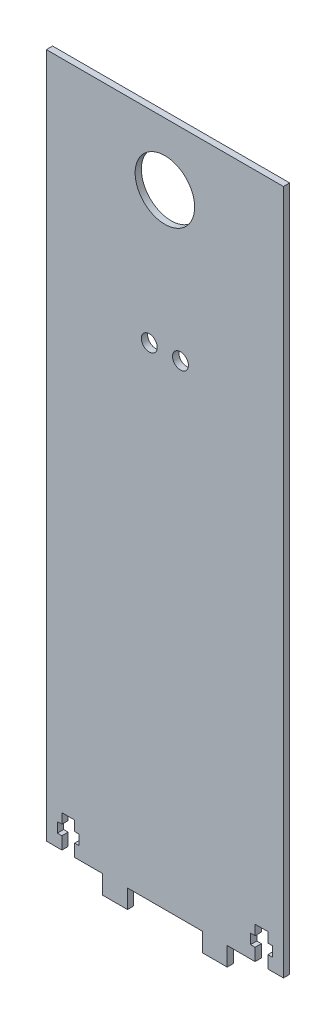
from build123d import *

# Parameters (mm, degrees)
SKETCH_1_R      = 9.55
SKETCH_1_R_2    = 2.55
EXTRUDE_1_DEPTH = 2


with BuildPart() as part:
    # 草图1 → 凸台-拉伸1 (new body)
    with BuildSketch(Plane.XY):
        Polygon((-28.741188564, 3.13029316), (-28.741188564, 7.13029316), (-27.291188564, 7.13029316), (-27.291188564, 10.33029316), (-28.741188564, 10.33029316), (-28.741188564, 13.53029316), (-32.841188564, 13.53029316), (-32.841188564, 10.33029316), (-34.291188564, 10.33029316), (-34.291188564, 7.13029316), (-32.841188564, 7.13029316), (-32.841188564, 3.13029316), (-37.841188564, 3.13029316), (-37.841188564, 223.13029316), (38.258811436, 223.13029316), (38.258811436, 3.13029316), (33.258811436, 3.13029316), (33.258811436, 7.13029316), (34.708811436, 7.13029316), (34.708811436, 10.33029316), (33.258811436, 10.33029316), (33.258811436, 13.53029316), (29.158811436, 13.53029316), (29.158811436, 10.33029316), (27.708811436, 10.33029316), (27.708811436, 7.13029316), (29.158811436, 7.13029316), (29.158811436, 3.13029316), (20.208811436, 3.13029316), (20.208811436, -2.86970684), (12.208811436, -2.86970684), (12.208811436, 3.13029316), (-11.791188564, 3.13029316), (-11.791188564, -2.86970684), (-19.791188564, -2.86970684), (-19.791188564, 3.13029316), align=None)
        with Locations((0.208811436, 203.13029316)):
            Circle(SKETCH_1_R, mode=Mode.SUBTRACT)
        with Locations((-4.791188564, 158.13029316)):
            Circle(SKETCH_1_R_2, mode=Mode.SUBTRACT)
        with Locations((5.208811436, 158.13029316)):
            Circle(SKETCH_1_R_2, mode=Mode.SUBTRACT)
    extrude(amount=EXTRUDE_1_DEPTH)


solid = part.part
